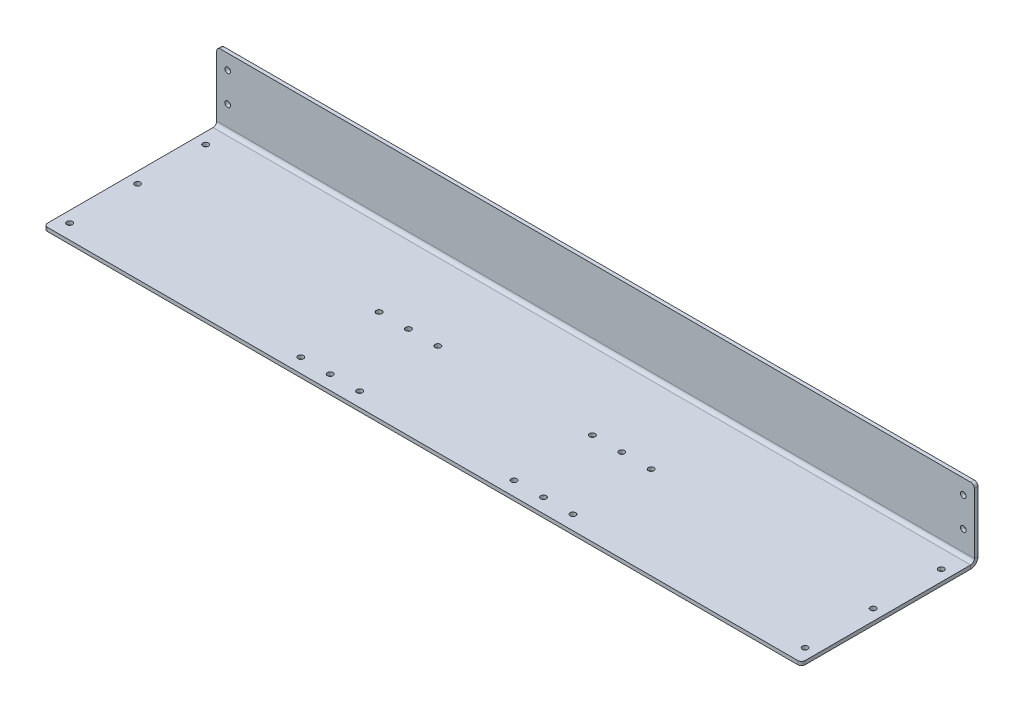
from build123d import *

# Parameters (mm, degrees)
BASE_FLANGE1_DEPTH = 654.05
SKETCH6_R          = 21.9075
CUT_EXTRUDE1_DEPTH = 3.175
SKETCH7_R          = 2.4257
CUT_EXTRUDE2_DEPTH = 683.89076222
SKETCH8_R          = 2.4257
CUT_EXTRUDE3_DEPTH = 683.89076222
SKETCH9_R          = 2.4257
CUT_EXTRUDE4_DEPTH = 683.89076222
FILLET1_R          = 3.175
SKETCH10_W         = 152.4
SKETCH10_H         = 61.9125
CUT_EXTRUDE6_DEPTH = 683.89076222
FILLET2_R          = 3.175


# Sheet-metal steps are written as plain solids
with BuildPart() as part:
    # Sketch1 → Base-Flange1 (new body)
    with BuildSketch(Plane(origin=(0, 0, 0), x_dir=(0, 0, -1), z_dir=(1, 0, 0))):
        with BuildLine():
            Line((0, 0), (146.05, 0))
            ThreePointArc((146.05, 0), (150.540128061, 1.859871939), (152.4, 6.35))
            Line((152.4, 6.35), (152.4, 117.475))
            ThreePointArc((152.4, 117.475), (150.540128061, 121.965128061), (146.05, 123.825))
            Line((146.05, 123.825), (0, 123.825))
            Line((0, 123.825), (0, 120.65))
            Line((0, 120.65), (146.05, 120.65))
            ThreePointArc((146.05, 120.65), (148.29506403, 119.72006403), (149.225, 117.475))
            Line((149.225, 117.475), (149.225, 6.35))
            ThreePointArc((149.225, 6.35), (148.29506403, 4.10493597), (146.05, 3.175))
            Line((146.05, 3.175), (0, 3.175))
            Line((0, 3.175), (0, 0))
        make_face()
    extrude(amount=BASE_FLANGE1_DEPTH)

    # Sketch6 → Cut-Extrude1 (cut)
    with BuildSketch(Plane(origin=(0, 123.825, 0), x_dir=(1, 0, 0), z_dir=(0, 1, 0))):
        with Locations(Location((234.95, 46.0375, 0), (0, 0, 270))):
            Circle(SKETCH6_R)
    extrude(amount=-CUT_EXTRUDE1_DEPTH, mode=Mode.SUBTRACT)

    # Sketch7 → Cut-Extrude2 (cut, through all)
    with BuildSketch(Plane(origin=(0, 123.825, 0), x_dir=(1, 0, 0), z_dir=(0, 1, 0))):
        with Locations(Location((234.95, 12.2555, 0), (0, 0, 270))):
            Circle(SKETCH7_R)
        with Locations(Location((234.95, 79.8195, 0), (0, 0, 270))):
            Circle(SKETCH7_R)
        with Locations(Location((209.55, 12.2555, 0), (0, 0, 270))):
            Circle(SKETCH7_R)
        with Locations(Location((260.35, 12.2555, 0), (0, 0, 270))):
            Circle(SKETCH7_R)
        with Locations(Location((260.35, 79.8195, 0), (0, 0, 270))):
            Circle(SKETCH7_R)
        with Locations(Location((209.55, 79.8195, 0), (0, 0, 270))):
            Circle(SKETCH7_R)
    cut_extrude2 = extrude(amount=-CUT_EXTRUDE2_DEPTH, mode=Mode.SUBTRACT)

    # Sketch8 → Cut-Extrude3 (cut, through all)
    with BuildSketch(Plane(origin=(0, 123.825, 0), x_dir=(1, 0, 0), z_dir=(0, 1, 0))):
        with Locations(Location((644.525, 12.7, 0), (0, 0, 270))):
            Circle(SKETCH8_R)
        with Locations(Location((644.525, 71.4375, 0), (0, 0, 270))):
            Circle(SKETCH8_R)
        with Locations(Location((644.525, 130.175, 0), (0, 0, 270))):
            Circle(SKETCH8_R)
        with Locations(Location((9.525, 130.175, 0), (0, 0, 270))):
            Circle(SKETCH8_R)
        with Locations(Location((9.525, 71.4375, 0), (0, 0, 270))):
            Circle(SKETCH8_R)
        with Locations(Location((9.525, 12.7, 0), (0, 0, 270))):
            Circle(SKETCH8_R)
    extrude(amount=-CUT_EXTRUDE3_DEPTH, mode=Mode.SUBTRACT)

    # Sketch9 → Cut-Extrude4 (cut, through all)
    with BuildSketch(Plane(origin=(0, 0, -152.4), x_dir=(-1, 0, 0), z_dir=(0, 0, -1))):
        with Locations((-644.525, 74.6125)):
            Circle(SKETCH9_R)
        with Locations((-644.525, 49.2125)):
            Circle(SKETCH9_R)
        with Locations((-9.525, 49.2125)):
            Circle(SKETCH9_R)
        with Locations((-9.525, 74.6125)):
            Circle(SKETCH9_R)
        with Locations((-644.525, 100.0125)):
            Circle(SKETCH9_R)
        with Locations((-644.525, 23.8125)):
            Circle(SKETCH9_R)
        with Locations((-9.525, 23.8125)):
            Circle(SKETCH9_R)
        with Locations((-9.525, 100.0125)):
            Circle(SKETCH9_R)
    extrude(amount=-CUT_EXTRUDE4_DEPTH, mode=Mode.SUBTRACT)

    # Fillet1
    fillet1_edges = [part.edges().sort_by_distance(p)[0] for p in [
        (0, 1.5875, 0),
        (0, 122.2375, 0),
        (654.05, 1.5875, 0),
        (654.05, 122.2375, 0),
    ]]
    fillet(fillet1_edges, radius=FILLET1_R)

    # Sketch10 → Cut-Extrude6 (cut, through all)
    with BuildSketch(Plane(origin=(654.05, 0, 0), x_dir=(0, 0, -1), z_dir=(1, 0, 0))):
        with Locations((76.2, 92.86875)):
            Rectangle(SKETCH10_W, SKETCH10_H)
    extrude(amount=-CUT_EXTRUDE6_DEPTH, mode=Mode.SUBTRACT)

    # Fillet2
    fillet2_edges = [part.edges().sort_by_distance(p)[0] for p in [
        (654.05, 61.9125, -150.8125),
        (0, 61.9125, -150.8125),
    ]]
    fillet(fillet2_edges, radius=FILLET2_R)

    # Mirror1: Cut-Extrude2 across plane
    add(cut_extrude2.mirror(Plane(origin=(327.025, 0, 0), x_dir=(0, 0, 1), z_dir=(1, 0, 0))), mode=Mode.SUBTRACT)


solid = part.part
